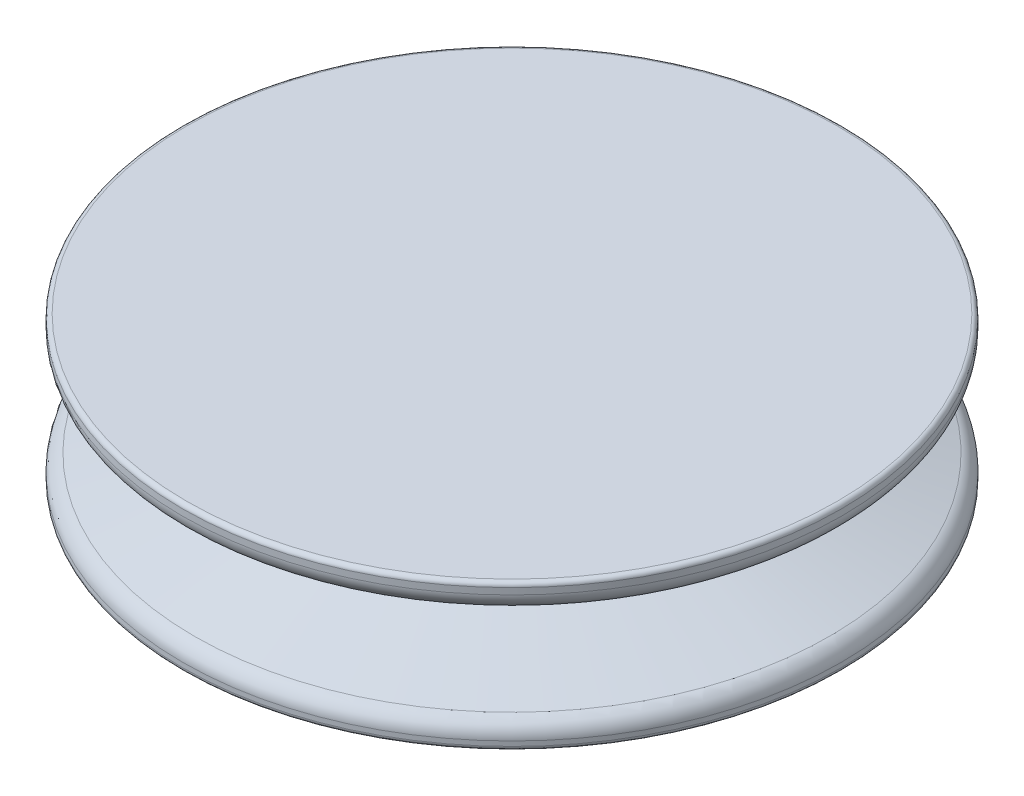
from build123d import *

# Parameters (mm, degrees)
SKETCH3_R           = 20
BOSS_EXTRUDE1_DEPTH = 12.5
FILLET1_R           = 4
FILLET2_R           = 1
FILLET3_R           = 2.4
FILLET4_R           = 10
BOSS_EXTRUDE2_REACH = 150.374
BOSS_EXTRUDE2_START = 39
SKETCH5_R           = 42.1
CHAMFER1_SIZE       = 2
CHAMFER1_SIZE2      = 11.342563639
FILLET5_R           = 2
SKETCH6_R           = 19.5
CUT_EXTRUDE1_DEPTH  = 2.3
BOSS_EXTRUDE3_DEPTH = 14.6
SKETCH8_R           = 7.3
BOSS_EXTRUDE4_DEPTH = 2
CHAMFER2_SIZE       = 1
CHAMFER3_SIZE       = 1
FILLET6_R           = 0.5
FILLET7_R           = 1


with BuildPart() as part:
    # Sketch2 → Revolve1 (revolve)
    with BuildSketch(Plane.XY):
        Polygon((0, 0), (-76.2, 0), (-76.2, -6.3), (0, -9.62696385), align=None)
    revolve(axis=Axis((0, 0, 0), (0, 1, 0)))

    # Sketch3 → Boss-Extrude1 (add)
    with BuildSketch(Plane(origin=(0, 0, 0), x_dir=(1, 0, 0), z_dir=(0, 1, 0))):
        Circle(SKETCH3_R)
    extrude(amount=-BOSS_EXTRUDE1_DEPTH)

    # Sketch4 → Revolve2 (revolve)
    with BuildSketch(Plane.XY):
        Polygon((-26, -12.5), (0, -12.5), (0, -15.1), (-25.588200455, -15.1), (-73.6, -30.699979324), (-73.6, -33.8), (-76.2, -33.8), (-76.2, -28.810968751), align=None)
    revolve(axis=Axis((0, 0, 0), (0, 1, 0)))

    # Fillet1
    fillet1_edges = [part.edges().sort_by_distance(p)[0] for p in [
        (76.2, -28.810968751, 0),
        (76.2, -6.3, 0),
    ]]
    fillet(fillet1_edges, radius=FILLET1_R)

    # Fillet2
    fillet2_edges = [part.edges().sort_by_distance(p)[0] for p in [
        (76.2, 0, 0),
        (73.6, -33.8, 0),
        (76.2, -33.8, 0),
    ]]
    fillet(fillet2_edges, radius=FILLET2_R)

    # Fillet3
    fillet3_edges = [part.edges().sort_by_distance(p)[0] for p in [
        (73.6, -30.699979324, 0),
    ]]
    fillet(fillet3_edges, radius=FILLET3_R)

    # Fillet4
    fillet4_edges = [part.edges().sort_by_distance(p)[0] for p in [
        (26, -12.5, 0),
    ]]
    fillet(fillet4_edges, radius=FILLET4_R)

    # Boss-Extrude2: up to this cone (the profile starts inside it)
    boss_extrude2_end = Plane(origin=(0, -54.1, 0), z_dir=(0, -1, 0)).offset(-47.314109319) * Cone(3.078e-06, 1058.125969925, 343.805967724, align=(Align.CENTER, Align.CENTER, Align.MIN), mode=Mode.PRIVATE)
    # Sketch5 → Boss-Extrude2 (add, up to the surface)
    with BuildSketch(Plane.XZ.offset(15.1).offset(BOSS_EXTRUDE2_START), mode=Mode.PRIVATE) as boss_extrude2_sk1:
        Circle(SKETCH5_R)
    boss_extrude2_tool1 = extrude(boss_extrude2_sk1.sketch, amount=-BOSS_EXTRUDE2_REACH, mode=Mode.PRIVATE) & boss_extrude2_end
    add(boss_extrude2_tool1.solids().sort_by_distance((0, -54.1, 0))[0])

    # Chamfer1
    chamfer1_edges = [part.edges().sort_by_distance(p)[0] for p in [
        (-42.1, -54.1, 0),
    ]]
    chamfer1_side = [part.faces().sort_by_distance(p)[0] for p in [
        (-42.1, -37.282504446, 0),
    ]]
    chamfer(chamfer1_edges, length=CHAMFER1_SIZE, length2=CHAMFER1_SIZE2, reference=chamfer1_side[0])

    # Fillet5
    fillet5_edges = [part.edges().sort_by_distance(p)[0] for p in [
        (-42.1, -52.1, 0),
    ]]
    fillet(fillet5_edges, radius=FILLET5_R)

    # Sketch6 → Cut-Extrude1 (cut)
    with BuildSketch(Plane.XZ.offset(54.1)):
        Circle(SKETCH6_R)
    extrude(amount=-CUT_EXTRUDE1_DEPTH, mode=Mode.SUBTRACT)

    # Sketch7 → Boss-Extrude3 (add)
    with BuildSketch(Plane.XZ.offset(51.8)):
        Polygon((-6.88490196, 11.925), (-13.76980392, 0), (-6.88490196, -11.925), (6.88490196, -11.925), (13.76980392, 0), (6.88490196, 11.925), align=None)
    extrude(amount=BOSS_EXTRUDE3_DEPTH)

    # Sketch8 → Boss-Extrude4 (add)
    with BuildSketch(Plane.XZ.offset(66.4)):
        Circle(SKETCH8_R)
    extrude(amount=BOSS_EXTRUDE4_DEPTH)

    # Chamfer2
    chamfer2_edges = [part.edges().sort_by_distance(p)[0] for p in [
        (-7.3, -68.4, 0),
    ]]
    chamfer(chamfer2_edges, length=CHAMFER2_SIZE)

    # Chamfer3
    chamfer3_edges = [part.edges().sort_by_distance(p)[0] for p in [
        (0, -66.4, 11.925),
        (10.32735294, -66.4, 5.9625),
        (10.32735294, -66.4, -5.9625),
        (0, -66.4, -11.925),
        (-10.32735294, -66.4, 5.9625),
        (-10.32735294, -66.4, -5.9625),
    ]]
    chamfer(chamfer3_edges, length=CHAMFER3_SIZE)

    # Fillet6
    fillet6_edges = [part.edges().sort_by_distance(p)[0] for p in [
        (-19.5, -54.1, 0),
    ]]
    fillet(fillet6_edges, radius=FILLET6_R)

    # Fillet7
    fillet7_edges = [part.edges().sort_by_distance(p)[0] for p in [
        (-20, -12.5, 0),
        (0, -8.753744991, 20),
    ]]
    fillet(fillet7_edges, radius=FILLET7_R)


solid = part.part
